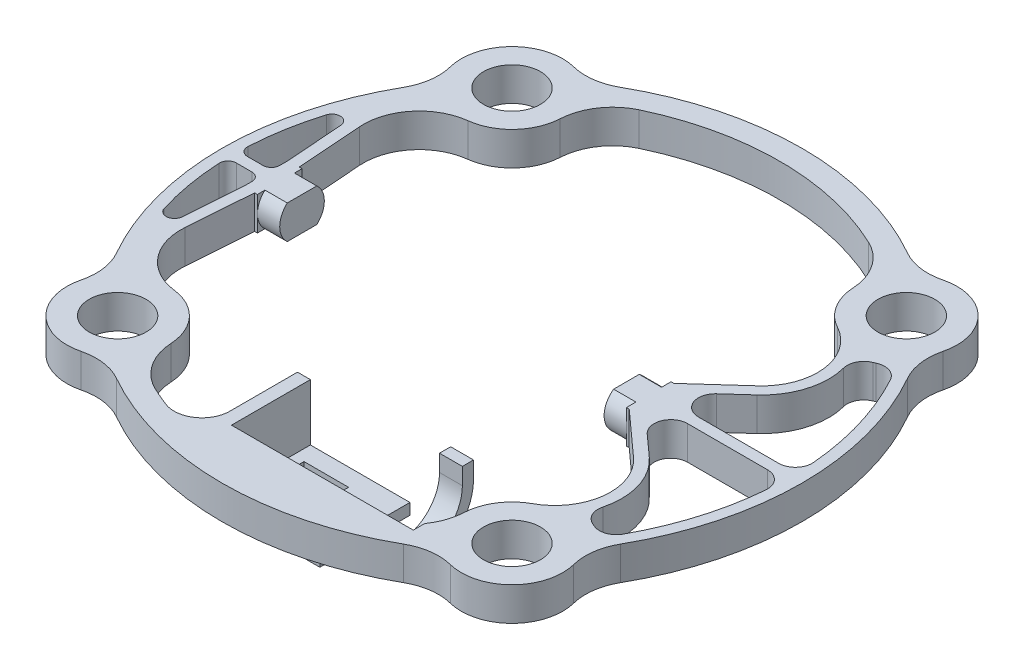
from build123d import *

# Parameters (mm, degrees)
SKETCH1_R            = 5.099999999999963
SKETCH1_R_2          = 5.099999999999999
SKETCH1_R_3          = 5.099999999999977
SKETCH1_R_4          = 5.100000000000024
BOSS_EXTRUDE1_DEPTH  = 6
FILLET1_R            = 10
BOSS_EXTRUDE2_START  = -6
BOSS_EXTRUDE2_DEPTH  = 6
BOSS_EXTRUDE3_START  = -6
BOSS_EXTRUDE3_DEPTH  = 6
FILLET2_R            = 10
CUT_EXTRUDE2_DEPTH   = 6
BOSS_EXTRUDE4_DEPTH  = 6
FILLET3_R            = 3
FILLET4_R            = 3
CUT_EXTRUDE3_START   = -6
CUT_EXTRUDE3_DEPTH   = 6
FILLET5_R            = 1.5
SKETCH8_W            = 13.196102501265209
SKETCH8_H            = 11.55899204058245
SKETCH8_R            = 4
CUT_EXTRUDE4_DEPTH   = 4
SKETCH9_W            = 12.005476711677371
SKETCH9_H            = 14.386728290853053
SKETCH9_R            = 4
CUT_EXTRUDE5_DEPTH   = 4
BOSS_EXTRUDE5_START  = -6
BOSS_EXTRUDE5_DEPTH  = 6
SKETCH11_W           = 2.3146668663284142
SKETCH11_H           = 14.149999999999995
BOSS_EXTRUDE6_DEPTH  = 6.15
BOSS_EXTRUDE7_DEPTH  = 4.1
BOSS_EXTRUDE8_DEPTH  = 6
SKETCH14_W           = 4.100000000000001
SKETCH14_H           = 2
BOSS_EXTRUDE9_DEPTH  = 3
SKETCH15_W           = 14.149999999999995
SKETCH15_H           = 2
BOSS_EXTRUDE10_DEPTH = 17.85
BOSS_EXTRUDE11_DEPTH = 2.25
SKETCH17_R           = 1.500000000000004
CUT_EXTRUDE6_DEPTH   = 3.5
CUT_EXTRUDE7_DEPTH   = 5.500000000000001
FILLET6_R            = 5
FILLET7_R            = 5
FILLET8_R            = 5
CUT_EXTRUDE8_DEPTH   = 13.5
FILLET9_R            = 5
SKETCH21_W           = 8.000000000000002
SKETCH21_H           = 8
CUT_EXTRUDE9_DEPTH   = 75.23626150898227


# Some blends are built 0.0001 mm under size
with BuildPart() as part:
    # Sketch1 → Boss-Extrude1 (new body)
    with BuildSketch(Plane(origin=(0, 0, 0), x_dir=(1, 0, 0), z_dir=(0, 1, 0))):
        with BuildLine():
            ThreePointArc((-42.589636171508175, 29.83492736338674), (-52, 6.37e-15), (-42.58963617150818, -29.834927363386726))
            ThreePointArc((-42.58963617150892, -29.834927363386416), (-41.79001076812464, -41.79001076812528), (-29.8349273633857, -42.589636171508374))
            ThreePointArc((-29.834927363385418, -42.5896361715091), (-9.55e-15, -52), (29.834927363385358, -42.589636171509134))
            ThreePointArc((29.83492736338569, -42.58963617150837), (41.790010768124965, -41.79001076812496), (42.58963617150836, -29.834927363385688))
            ThreePointArc((42.58963617150913, -29.834927363385383), (52.00000000000001, 8.2423e-13), (42.58963617150818, 29.83492736338673))
            ThreePointArc((42.58963617150892, 29.834927363386416), (41.790010768124965, 41.79001076812495), (29.834927363386427, 42.58963617150893))
            ThreePointArc((29.834927363386733, 42.58963617150818), (1.066e-14, 52), (-29.83492736338672, 42.58963617150818))
            ThreePointArc((-29.834927363386416, 42.58963617150892), (-41.79001076812496, 41.79001076812496), (-42.58963617150892, 29.83492736338642))
        make_face()
        with Locations(Location((-35.355339059327406, -35.35533905932735, 0), (0, 0, 270))):
            Circle(SKETCH1_R, mode=Mode.SUBTRACT)
        with Locations(Location((35.35533905932738, -35.35533905932738, 0), (0, 0, 270))):
            Circle(SKETCH1_R_2, mode=Mode.SUBTRACT)
        with Locations(Location((-35.3553390593274, 35.35533905932736, 0), (0, 0, 270))):
            Circle(SKETCH1_R_3, mode=Mode.SUBTRACT)
        with BuildLine():
            ThreePointArc((-27.2586404264471, -39.50906885895502), (-28.920667350529797, -28.920667350529794), (-39.50906885895502, -27.2586404264471))
            ThreePointArc((-39.509068858954805, -27.2586404264477), (-48.00000000000001, 5.88e-15), (-39.50906885895479, 27.258640426447702))
            ThreePointArc((-39.50906885895502, 27.2586404264471), (-28.920667350529797, 28.92066735052979), (-27.258640426447098, 39.50906885895501))
            ThreePointArc((-27.258640426447712, 39.50906885895479), (2.94e-15, 48.00000000000001), (27.258640426447723, 39.509068858954784))
            ThreePointArc((27.2586404264471, 39.50906885895501), (28.920667350529794, 28.9206673505298), (39.509068858955004, 27.258640426447098))
            ThreePointArc((39.509068858954784, 27.25864042644773), (48.000000000000014, -3.55e-15), (39.509068858954784, -27.258640426447727))
            ThreePointArc((39.509068858955004, -27.258640426447094), (28.920667350529797, -28.920667350529797), (27.2586404264471, -39.509068858955004))
            ThreePointArc((27.258640426447734, -39.50906885895478), (1.421e-14, -48.000000000000014), (-27.258640426447716, -39.509068858954784))
        make_face(mode=Mode.SUBTRACT)
        with Locations(Location((35.3553390593274, 35.35533905932736, 0), (0, 0, 270))):
            Circle(SKETCH1_R_4, mode=Mode.SUBTRACT)
    extrude(amount=BOSS_EXTRUDE1_DEPTH)

    # Fillet1
    fillet1_edges = [part.edges().sort_by_distance(p)[0] for p in [
        (-42.58963617150856, 3, 29.834927363386576),
        (-42.589636171508545, 3, -29.834927363386583),
        (-29.83492736338657, 3, -42.58963617150856),
        (29.834927363386583, 3, -42.58963617150856),
        (42.58963617150856, 3, -29.834927363386573),
        (42.589636171508744, 3, 29.834927363385535),
        (29.834927363385532, 3, 42.58963617150876),
        (-29.83492736338556, 3, 42.589636171508744),
        (27.258640426447418, 3, 39.50906885895489),
        (39.50906885895489, 3, 27.258640426447414),
        (39.50906885895489, 3, -27.258640426447414),
        (27.258640426447414, 3, -39.50906885895489),
        (-27.2586404264474, 3, -39.509068858954905),
        (-39.509068858954905, 3, -27.2586404264474),
        (-39.50906885895491, 3, 27.2586404264474),
        (-27.258640426447407, 3, 39.509068858954905),
    ]]
    fillet(fillet1_edges, radius=FILLET1_R)

    # Sketch2 → Boss-Extrude2 (add)
    with BuildSketch(Plane(origin=(0, 6, 0), x_dir=(1, 0, 0), z_dir=(0, 1, 0)).offset(BOSS_EXTRUDE2_START)):
        with BuildLine():
            Line((-37.65, 4), (-47.8330429724056, 4))
            ThreePointArc((-47.83304297240559, 3.9999999999999996), (-48, -1.1e-16), (-47.83304297240559, -3.9999999999999982))
            Line((-47.8330429724056, -4), (-37.65, -4))
            Line((-37.65, -4), (-37.65, 4))
        make_face()
        with BuildLine():
            ThreePointArc((47.8330429724056, -4.000000000000002), (48.000000000000014, -1.33e-15), (47.8330429724056, 4))
            Line((47.8330429724056, 4), (20.52, 4))
            Line((20.52, 4), (20.52, -4))
            Line((20.52, -4), (47.8330429724056, -4))
        make_face()
    extrude(amount=BOSS_EXTRUDE2_DEPTH)

    # Sketch3 → Boss-Extrude3 (add)
    with BuildSketch(Plane(origin=(0, 6, 0), x_dir=(1, 0, 0), z_dir=(0, 1, 0)).offset(BOSS_EXTRUDE3_START)):
        with BuildLine():
            Line((-47.8330429724056, 4), (-42.14999999999999, 4))
            Line((-42.14999999999999, 4), (-43.370230256575944, 20.567526042078697))
            ThreePointArc((-43.37023025657595, 20.5675260420787), (-46.34792327288036, 12.484791079196981), (-47.83304297240561, 4.000000000000001))
        make_face()
        with BuildLine():
            Line((-43.37023025657595, -20.56752604207868), (-42.14999999999999, -4))
            Line((-42.14999999999999, -4), (-47.8330429724056, -4))
            ThreePointArc((-47.83304297240559, -4.000000000000008), (-46.34792327288035, -12.48479107919697), (-43.37023025657595, -20.56752604207868))
        make_face()
        with BuildLine():
            Line((43.37023025657595, 20.56752604207868), (25.02, 4))
            Line((25.02, 4), (47.8330429724056, 4))
            ThreePointArc((47.8330429724056, 3.9999999999999982), (46.34792327288036, 12.484791079196969), (43.37023025657596, 20.56752604207868))
        make_face()
        with BuildLine():
            Line((47.8330429724056, -4), (25.02, -4))
            Line((25.02, -4), (43.370230256575944, -20.567526042078697))
            ThreePointArc((43.370230256575944, -20.567526042078704), (46.34792327288036, -12.484791079196986), (47.8330429724056, -4.000000000000007))
        make_face()
    extrude(amount=BOSS_EXTRUDE3_DEPTH)

    # Fillet2
    fillet2_edges = [part.edges().sort_by_distance(p)[0] for p in [
        (43.370230256575944, 2.9999999999999947, 20.567526042078697),
        (43.37023025657595, 2.9999999999999925, -20.56752604207869),
        (-43.37023025657595, 3.000000000000001, 20.56752604207869),
        (-43.37023025657594, 3.000000000000003, -20.567526042078697),
    ]]
    fillet(fillet2_edges, radius=FILLET2_R - 0.0001)  # a hair under: the kernel refuses the full size

    # Sketch5 → Cut-Extrude2 (cut)
    with BuildSketch(Plane(origin=(0, 6, 0), x_dir=(1, 0, 0), z_dir=(0, 1, 0))):
        with BuildLine():
            ThreePointArc((38.237657421795525, 18.57207711307228), (37.20349447624699, 13.698637086230962), (34.27925447259233, 9.665185574908357))
            Line((34.27925447259233, 9.665185574908358), (27.020000000000003, 3.1111595033373005))
            Line((27.020000000000003, 3.1111595033373), (27.020000000000003, -3.1111595033471926))
            Line((27.020000000000003, -3.111159503347192), (34.27925447258564, -9.66518557490234))
            ThreePointArc((34.27925447258564, -9.665185574902342), (37.20349447624515, -13.698637086226856), (38.237657421795504, -18.572077113072286))
            ThreePointArc((38.237657421795504, -18.57207711307229), (37.86190003304607, -21.55150385571701), (36.75816013599775, -24.34434032956399))
            ThreePointArc((36.75816013599784, -24.344340329564076), (39.68242206988196, -25.133482446178775), (42.28449514351011, -26.68373044494484))
            ThreePointArc((42.284495143510036, -26.683730444944835), (48.03240966876168, -13.888398806638916), (50, -1.225e-14))
            ThreePointArc((50, 0), (48.03240966876169, 13.888398806638897), (42.28449514351005, 26.68373044494482))
            ThreePointArc((42.28449514351011, 26.68373044494484), (39.682422069881966, 25.133482446178775), (36.75816013599786, 24.344340329564076))
            ThreePointArc((36.75816013599777, 24.344340329563988), (37.8619000330461, 21.551503855717), (38.237657421795525, 18.572077113072282))
        make_face()
    extrude(amount=-CUT_EXTRUDE2_DEPTH, mode=Mode.SUBTRACT)

    # Sketch6 → Boss-Extrude4 (add)
    with BuildSketch(Plane(origin=(0, 6, 0), x_dir=(1, 0, 0), z_dir=(0, 1, 0))):
        Polygon((27.020000000000003, 0.9819090006175923), (49.99035761738963, 0.9819090006175919), (51.19424294426267, 0.9819090006175919), (51.19424294426267, -1.018090999382408), (49.989633832595494, -1.018090999382408), (27.020000000000003, -1.0180909993824077), align=None)
    extrude(amount=-BOSS_EXTRUDE4_DEPTH)

    # Fillet3
    # the kernel refuses this fillet: 3 mm, written as the material it adds along each edge
    with BuildSketch(Plane(origin=(27.020000000000003, 6, -0.9819090006175923), x_dir=(0, 0, -1), z_dir=(0, -1, 0))) as fillet3_piece_1:
        with BuildLine():
            CenterArc((3, 2.8708527153070946), FILLET3_R, 180, 73.12708628528327)
            Line((-2.2e-16, 2.8708527153070946), (-0.06000000000000028, 2.8708527153070946))
            Line((-0.06000000000000028, 2.8708527153070946), (-0.06000000000000005, 0))
            Line((-0.06000000000000005, 0), (0, -0.05999999999999872))
            ThreePointArc((0, -0.05999999999999872), (1.064625251359854, -0.05999999999999872), (2.1118355127741024, -0.05741705430614275))
            Line((2.1118355127741024, -0.05741705430614275), (2.1292505027197084, 0))
        make_face()
    extrude(amount=6)
    with BuildSketch(Plane(origin=(27.020000000000003, 6, 1.0180909993824077), x_dir=(0, 0, 1), z_dir=(0, -1, 0))) as fillet3_piece_2:
        with BuildLine():
            CenterArc((3, -2.859628518094496), FILLET3_R, 107.596430009701, 72.403569990299)
            Line((2.2e-16, -2.859628518094496), (-0.05999999999999983, -2.859628518094496))
            Line((-0.05999999999999983, -2.859628518094496), (-0.06000000000000005, 0))
            Line((-0.06000000000000005, 0), (0, 0.05999999999999872))
            ThreePointArc((0, 0.05999999999999872), (1.0465342519823924, 0.05999999999999872), (2.07492987404408, 0.05719257036189163))
            Line((2.07492987404408, 0.05719257036189163), (2.0930685039647843, 0))
        make_face()
    extrude(amount=6)
    with BuildSketch(Plane(origin=(36.7581601359978, 6, 24.344340329564034), x_dir=(0.3686768777675154, 0, -0.9295576151049468), z_dir=(0, -1, 0))) as fillet3_piece_3:
        with BuildLine():
            CenterArc((3.345716556141784, 2.976878348256868), FILLET3_R, 180.89962430391978, 81.98224825656462)
            Line((0.3460863497763565, 2.9297760652963665), (0.28609374564904577, 2.928834019637155))
            ThreePointArc((0.28609374564904577, 2.928834019637155), (0.21122512417191133, 1.4603777045000785), (-0.05812186710148964, 0.01489458172076869))
            Line((-0.05812186710148964, 0.01489458172076869), (0.00743492568031723, -0.05953756696513596))
            ThreePointArc((0.00743492568031723, -0.05953756696513596), (1.4869851360630424, 0.03248660697253327), (2.966535346445779, -0.05953756696513431))
            Line((2.966535346445779, -0.05953756696513431), (2.973970272126092, -1.5e-16))
        make_face()
    extrude(amount=6)
    with BuildSketch(Plane(origin=(42.28449514351007, 6, 26.68373044494484), x_dir=(-0.8512706925591004, 0, -0.5247267936649983), z_dir=(0, -1, 0))) as fillet3_piece_4:
        with BuildLine():
            CenterArc((3.0611464220846627, 2.97778381773632), FILLET3_R, 177.01132377378212, 86.01149357067823)
            Line((0.06522684574595612, 3.1341995845583397), (0.00530845421918353, 3.1373278998947787))
            ThreePointArc((0.00530845421918353, 3.1373278998947787), (-0.05194296104754635, 1.5688595226543562), (-0.05999666374167063, -0.00063272416503647))
            Line((-0.05999666374167063, -0.00063272416503647), (0.00728844386210776, -0.05955567635472604))
            ThreePointArc((0.00728844386210776, -0.05955567635472604), (1.3483621144896634, 0.02219987437561363), (2.689435785117221, -0.05955567635472756))
            Line((2.689435785117221, -0.05955567635472756), (2.696724228979326, 2e-17))
        make_face()
    extrude(amount=6)
    with BuildSketch(Plane(origin=(49.9896338325955, 0, 1.018090999382408), x_dir=(-0.0529547236137434, 0, 0.9985969142987535), z_dir=(0, 1, 0))) as fillet3_piece_5:
        with BuildLine():
            CenterArc((3.1632179426355167, -2.998404409178422), FILLET3_R, 88.13122498852314, 94.90427700248017)
            Line((0.16742719973925577, -3.157268580019652), (0.1075113848813305, -3.1604458634364767))
            Line((0.1075113848813305, -3.1604458634364767), (-0.05991581485792526, -0.00317728341682461))
            Line((-0.05991581485792526, -0.00317728341682461), (-0.00195662965523841, 0.05996808818356544))
            ThreePointArc((-0.00195662965523841, 0.05996808818356544), (1.6305247126987177, 0.08659318035961931), (3.2630060550526774, 0.05996808818356832))
            Line((3.2630060550526774, 0.05996808818356832), (3.261049425397439, 0))
        make_face()
    extrude(amount=6)
    with BuildSketch(Plane(origin=(49.99035761738964, 0, -0.9819090006175919), x_dir=(-0.05220754978421727, 0, -0.9986362559738798), z_dir=(0, 1, 0))) as fillet3_piece_6:
        with BuildLine():
            CenterArc((3.160850062556177, 2.99840679773152), FILLET3_R, 177.00736721989773, 94.86000839284759)
            Line((0.16494129463453752, 3.1550294470841647), (0.10502311927610468, 3.1581619000712178))
            Line((0.10502311927610468, 3.1581619000712178), (-0.05991817535843284, 0.00313245298705304))
            Line((-0.05991817535843284, 0.00313245298705304), (-0.00195516498714811, -0.05996813595462845))
            ThreePointArc((-0.00195516498714811, -0.05996813595462845), (1.629304155956785, -0.08655337114138394), (3.2605634769007272, -0.05996813595463082))
            Line((3.2605634769007272, -0.05996813595463082), (3.2586083119135796, 0))
        make_face()
    extrude(amount=6)
    with BuildSketch(Plane(origin=(36.75816013599781, 6, -24.34434032956403), x_dir=(0.3686768777675187, 0, 0.9295576151049456), z_dir=(0, -1, 0))) as fillet3_piece_7:
        with BuildLine():
            CenterArc((3.3457165561417908, -2.9768783482568657), FILLET3_R, 97.11812743951585, 81.9822482565646)
            Line((0.34608634977635955, -2.9297760652963762), (0.2860937456490488, -2.9288340196371645))
            ThreePointArc((0.2860937456490488, -2.9288340196371645), (0.21122512417191577, -1.4603777045000856), (-0.05812186710148959, -0.0148945817207689))
            Line((-0.05812186710148959, -0.0148945817207689), (0.00743492568031702, 0.05953756696513599))
            ThreePointArc((0.00743492568031702, 0.05953756696513599), (1.486985136063038, -0.03248660697254525), (2.9665353464457715, 0.05953756696513415))
            Line((2.9665353464457715, 0.05953756696513415), (2.973970272126085, -5e-17))
        make_face()
    extrude(amount=6)
    with BuildSketch(Plane(origin=(42.284495143510085, 6, -26.683730444944832), x_dir=(0.5069009623645678, 0, 0.8620043006585727), z_dir=(0, -1, 0))) as fillet3_piece_8:
        with BuildLine():
            CenterArc((3.040831892432753, 2.998525518414092), FILLET3_R, 185.78495367741579, 86.01149357067038)
            Line((0.05611025432539941, 2.69614042781974), (-0.00358417843674884, 2.690092726007855))
            ThreePointArc((-0.00358417843674884, 2.690092726007855), (0.05025019559160608, 1.3476083051303924), (-0.0593911340901195, 0.00852603023038361))
            Line((-0.0593911340901195, 0.00852603023038361), (-0.00188092694377259, -0.05997051036828272))
            ThreePointArc((-0.00188092694377259, -0.05997051036828272), (1.5674391198106752, -0.08457469309852138), (3.1367591665651227, -0.05997051036828362))
            Line((3.1367591665651227, -0.05997051036828362), (3.13487823962135, -1.7e-16))
        make_face()
    extrude(amount=6)

    # Fillet4
    fillet4_edges = [part.edges().sort_by_distance(p)[0] for p in [
        (27.020000000000003, 3, -3.1111595033373005),
    ]]
    fillet(fillet4_edges, radius=FILLET4_R)
    fillet4_2_edges = [part.edges().sort_by_distance(p)[0] for p in [
        (27.020000000000003, 3, 3.111159503347192),
    ]]
    fillet(fillet4_2_edges, radius=FILLET4_R)

    # Sketch7 → Cut-Extrude3 (cut)
    with BuildSketch(Plane.XZ.offset(CUT_EXTRUDE3_START)):
        with BuildLine():
            Line((-44.14999999999999, 3.9264476838978197), (-45.403197170618576, 20.941577941643605))
            ThreePointArc((-45.40319717061856, 20.94157794164361), (-48.72763180786275, 11.20793907894589), (-49.98999899979993, 1.000000000001045))
            Line((-49.98999899979991, 0.9999999999999938), (-44.14999999999999, 0.9999999999999946))
            Line((-44.14999999999999, 0.9999999999999947), (-44.14999999999999, 3.9264476838978197))
        make_face()
        with BuildLine():
            ThreePointArc((-49.98999899979993, -1.0000000000010327), (-48.72763180786276, -11.207939078945877), (-45.403197170618554, -20.941577941643637))
            Line((-45.40319717061855, -20.941577941643633), (-44.14999999999999, -3.9264476838977123))
            Line((-44.14999999999999, -3.9264476838977123), (-44.14999999999999, -1))
            Line((-44.14999999999999, -1), (-49.98999899979991, -1))
        make_face()
    extrude(amount=CUT_EXTRUDE3_DEPTH, mode=Mode.SUBTRACT)

    # Fillet5
    # the kernel refuses this fillet: 1.5 mm, written as the material it adds along each edge
    with BuildSketch(Plane(origin=(-45.40319717061857, 6, 20.941577941643608), x_dir=(-0.35566095703559125, 0, -0.9346150456955673), z_dir=(0, -1, 0))) as fillet5_piece_1:
        with BuildLine():
            CenterArc((6.745613455376667, 1.4964783855270851), FILLET5_R, 115.0462972690573, 158.88058526223008)
            Line((6.110587770722799, 2.855427383771646), (0, 0))
            ThreePointArc((0, 0), (3.4241692666886636, -0.11738714909708475), (6.848338533377325, 3e-17))
        make_face()
    extrude(amount=6)
    with BuildSketch(Plane(origin=(-44.14999999999999, 6, 3.9264476838978197), x_dir=(-0.07345297200060777, 0, 0.9972986818923797), z_dir=(0, -1, 0))) as fillet5_piece_2:
        with BuildLine():
            CenterArc((FILLET5_R * 0.0367761580511, FILLET5_R), FILLET5_R, 265.78766107236066, 4.212338927640246)
            Line((-FILLET5_R * 0.0366768139495, FILLET5_R * 0.00270131810762), (0, 0))
            Line((0, 0), (FILLET5_R * 0.0367761580511, 0))
        make_face()
    extrude(amount=6)
    with BuildSketch(Plane(origin=(-44.14999999999999, 6, 0.9999999999999947), x_dir=(0, 0, 1), z_dir=(0, -1, 0))) as fillet5_piece_3:
        with BuildLine():
            CenterArc((FILLET5_R, FILLET5_R), FILLET5_R, 180, 90)
            Line((0, FILLET5_R), (0, 0))
            Line((0, 0), (FILLET5_R, 0))
        make_face()
    extrude(amount=6)
    with BuildSketch(Plane(origin=(-49.98999899979992, 6, 1.0000000000005203), x_dir=(0.0357776524855417, 0, 0.9993597748471889), z_dir=(0, -1, 0))) as fillet5_piece_4:
        with BuildLine():
            CenterArc((1.5546551231276617, -1.4998131539261013), FILLET5_R, 89.09564593035947, 92.95470013766749)
            Line((0.05561546085687804, -1.5534796326543996), (0, 0))
            ThreePointArc((0, 0), (0.7891650371206554, 0.00622820246320295), (1.5783300742413102, 0))
        make_face()
    extrude(amount=6)
    with BuildSketch(Plane(origin=(-49.98999899979992, 6, -1.0000000000005165), x_dir=(1, 0, 3.3225e-13), z_dir=(0, -1, 0))) as fillet5_piece_5:
        with BuildLine():
            CenterArc((1.554474846550007, -1.5), FILLET5_R, 89.99999999998097, 92.95470013766811)
            ThreePointArc((0.0564689449030968, -1.57731958762837), (0.02201025744025821, -0.7888826242775202), (0, 0))
            Line((0, 0), (1.5544748465505052, 0))
        make_face()
    extrude(amount=6)
    with BuildSketch(Plane(origin=(-44.14999999999999, 6, -1), x_dir=(-1, 0, 0), z_dir=(0, -1, 0))) as fillet5_piece_6:
        with BuildLine():
            CenterArc((FILLET5_R, FILLET5_R), FILLET5_R, 180, 90)
            Line((0, FILLET5_R), (0, 0))
            Line((0, 0), (FILLET5_R, 0))
        make_face()
    extrude(amount=6)
    with BuildSketch(Plane(origin=(-44.14999999999999, 6, -3.9264476838977123), x_dir=(0, 0, 1), z_dir=(0, -1, 0))) as fillet5_piece_7:
        with BuildLine():
            CenterArc((FILLET5_R * 0.0367761580511, FILLET5_R), FILLET5_R, 265.78766107236, 4.212338927640019)
            Line((-FILLET5_R * 0.0366768139495, FILLET5_R * 0.00270131810762), (0, 0))
            Line((0, 0), (FILLET5_R * 0.0367761580511, 0))
        make_face()
    extrude(amount=6)
    with BuildSketch(Plane(origin=(-45.40319717061855, 6, -20.941577941643637), x_dir=(0.07345297200062204, 0, 0.9972986818923786), z_dir=(0, -1, 0))) as fillet5_piece_8:
        with BuildLine():
            CenterArc((6.744831239378959, 1.5000000000000004), FILLET5_R, 111.11941473771157, 158.8805852622885)
            ThreePointArc((6.204361859716742, 2.8992472439306565), (3.052485026709371, 1.5559723877450613), (0, 0))
            Line((0, 0), (6.744831239378961, -2e-17))
        make_face()
    extrude(amount=6)

    # Sketch8 → Cut-Extrude4 (cut)
    with BuildSketch(Plane(origin=(-37.65, 0, 0), x_dir=(0, 0, -1), z_dir=(1, 0, 0))):
        with Locations((0, 2.9999999999999996)):
            Rectangle(SKETCH8_W, SKETCH8_H)
        with Locations((0, 3)):
            Circle(SKETCH8_R, mode=Mode.SUBTRACT)
    extrude(amount=-CUT_EXTRUDE4_DEPTH, mode=Mode.SUBTRACT)

    # Sketch9 → Cut-Extrude5 (cut)
    with BuildSketch(Plane.ZY.offset(-20.52)):
        with Locations((0, 2.727148256552649)):
            Rectangle(SKETCH9_W, SKETCH9_H)
        with Locations((0, 2.7271482565526486)):
            Circle(SKETCH9_R, mode=Mode.SUBTRACT)
    extrude(amount=-CUT_EXTRUDE5_DEPTH, mode=Mode.SUBTRACT)

    # Sketch10 → Boss-Extrude5 (add)
    with BuildSketch(Plane(origin=(0, 6, 0), x_dir=(1, 0, 0), z_dir=(0, 1, 0)).offset(BOSS_EXTRUDE5_START)):
        with BuildLine():
            Line((-10.464666866328413, -28), (-10.464666866328413, -46.84539195456443))
            ThreePointArc((-10.464666866328413, -46.84539195456443), (4.459052848216454, -47.7924350467395), (18.95000000000001, -44.100992052333716))
            Line((18.95000000000001, -44.100992052333716), (18.95000000000001, -42.15))
            Line((18.95000000000001, -42.15), (14.700000000000006, -42.15))
            Line((14.700000000000006, -42.15), (-8.149999999999999, -42.15))
            Line((-8.149999999999999, -42.15), (-8.149999999999997, -28))
            Line((-8.149999999999997, -28), (-10.464666866328413, -28))
        make_face()
    extrude(amount=BOSS_EXTRUDE5_DEPTH)

    # Sketch11 → Boss-Extrude6 (add)
    with BuildSketch(Plane.XZ):
        Polygon((-10.464666866328413, 44.15), (-10.464666866328413, 42.15), (-8.149999999999999, 42.15), (9.700000000000005, 42.15), (9.700000000000005, 44.15), align=None)
        with Locations((-9.307333433164207, 35.075)):
            Rectangle(SKETCH11_W, SKETCH11_H)
    extrude(amount=BOSS_EXTRUDE6_DEPTH)

    # Sketch12 → Boss-Extrude7 (add)
    with BuildSketch(Plane(origin=(18.95000000000001, 0, 0), x_dir=(0, 0, -1), z_dir=(1, 0, 0))):
        with BuildLine():
            Line((-25.850000000000005, 3), (-27.85, 3))
            ThreePointArc((-27.85, 2.9999999999999982), (-35, -4.149999999999999), (-42.15, 3.000000000000001))
            Line((-42.15, 3.000000000000028), (-42.15, 0))
            Line((-42.15, 0), (-43.644217720534414, 0))
            ThreePointArc((-43.644217720534385, 1.1768e-13), (-33.478831393778066, -6.022668456251997), (-25.85, 2.999999999999998))
        make_face()
    extrude(amount=-BOSS_EXTRUDE7_DEPTH)

    # Sketch13 → Boss-Extrude8 (add)
    with BuildSketch(Plane(origin=(0, 6, 0), x_dir=(1, 0, 0), z_dir=(0, 1, 0))):
        Polygon((18.95000000000001, -42.15), (24.139354243800483, -42.15), (18.95000000000001, -46.44899679624902), align=None)
    extrude(amount=-BOSS_EXTRUDE8_DEPTH)

    # Sketch14 → Boss-Extrude9 (add)
    with BuildSketch(Plane(origin=(0, 3, 0), x_dir=(1, 0, 0), z_dir=(0, 1, 0))):
        with Locations((16.90000000000001, -26.85000000000001)):
            Rectangle(SKETCH14_W, SKETCH14_H)
    extrude(amount=BOSS_EXTRUDE9_DEPTH)

    # Sketch15 → Boss-Extrude10 (add)
    with BuildSketch(Plane(origin=(-8.149999999999993, 0, -1e-15), x_dir=(1.2e-16, 0, -1), z_dir=(1, 0, 1.2e-16))):
        with Locations((-35.075, -5.15)):
            Rectangle(SKETCH15_W, SKETCH15_H)
    extrude(amount=BOSS_EXTRUDE10_DEPTH)

    # Sketch16 → Boss-Extrude11 (add)
    with BuildSketch(Plane(origin=(0, -6.15, 0), x_dir=(-1, 0, 0), z_dir=(0, -1, 0))):
        Polygon((-9.700000000000003, -42.15), (-4.700000000000002, -42.15), (-4.700000000000003, -28), (-9.700000000000003, -28.000000000000004), align=None)
    extrude(amount=BOSS_EXTRUDE11_DEPTH)

    # Sketch17 → Cut-Extrude6 (cut)
    with BuildSketch(Plane(origin=(9.700000000000005, 0, 0), x_dir=(0, 0, -1), z_dir=(1, 0, 0))):
        with Locations((-35.42111724023818, -6.275)):
            Circle(SKETCH17_R)
    extrude(amount=-CUT_EXTRUDE6_DEPTH, mode=Mode.SUBTRACT)

    # Sketch18 → Cut-Extrude7 (cut)
    with BuildSketch(Plane(origin=(9.700000000000005, 0, 0), x_dir=(0, 0, -1), z_dir=(1, 0, 0))):
        with BuildLine():
            Line((-37.542437583797835, -6.15), (-42.15, -6.15))
            Line((-42.15, -6.15), (-42.15, -8.4))
            Line((-42.15, -8.4), (-35.421117240238374, -8.4))
            ThreePointArc((-35.421117240238374, -8.400000000000002), (-36.96728184984486, -7.7327379737112745), (-37.54243758379783, -6.150000000000048))
        make_face()
        with BuildLine():
            Line((-28, -6.15), (-33.299796896678544, -6.15))
            ThreePointArc((-33.29979689667854, -6.149999999999951), (-33.29703735355027, -6.212472926120896), (-33.29611724023818, -6.275))
            ThreePointArc((-33.29611724023818, -6.275000000000001), (-33.918515330216835, -7.777601910021484), (-35.421117240238374, -8.400000000000002))
            Line((-35.421117240238374, -8.4), (-28.000000000000004, -8.4))
            Line((-28.000000000000004, -8.4), (-28, -6.15))
        make_face()
    extrude(amount=-CUT_EXTRUDE7_DEPTH, mode=Mode.SUBTRACT)

    # Fillet6
    fillet6_edges = [part.edges().sort_by_distance(p)[0] for p in [
        (7.200000000000003, -6.150000000000024, 37.542437583797835),
        (7.200000000000004, -6.1499999999999755, 33.299796896678544),
    ]]
    fillet(fillet6_edges, radius=FILLET6_R)

    # Fillet7
    # the kernel refuses this fillet: 5 mm, written as the material it adds along each edge
    with BuildSketch(Plane(origin=(9.700000000000005, 0, 44.15), x_dir=(0, -1, 0), z_dir=(-1, 0, 0))) as fillet7_piece_1:
        with BuildLine():
            CenterArc((FILLET7_R, FILLET7_R), FILLET7_R, 179.99999999999991, 90.00000000000011)
            Line((-8.9e-16, FILLET7_R), (0, 0))
            Line((0, 0), (FILLET7_R, 0))
        make_face()
    extrude(amount=20.164666866328417)

    # Fillet8
    fillet8_edges = [part.edges().sort_by_distance(p)[0] for p in [
        (-10.464666866328415, 3, 46.845391954564434),
    ]]
    fillet(fillet8_edges, radius=FILLET8_R)

    # Sketch19 → Cut-Extrude8 (cut)
    with BuildSketch(Plane(origin=(0, 6, 0), x_dir=(1, 0, 0), z_dir=(0, 1, 0))):
        Polygon((18.95000000000001, -25.850000000000005), (24.450000000000006, -25.850000000000005), (24.45000000000001, -42.15), (18.950000000000014, -42.15), align=None)
    extrude(amount=-CUT_EXTRUDE8_DEPTH, mode=Mode.SUBTRACT)

    # Fillet9
    fillet9_edges = [part.edges().sort_by_distance(p)[0] for p in [
        (16.90000000000001, 5.884e-14, 43.6442177205344),
    ]]
    fillet(fillet9_edges, radius=FILLET9_R)

    # Sketch21 → Cut-Extrude9 (cut, through all)
    with BuildSketch(Plane(origin=(0, -4.15, 0), x_dir=(1, 0, 0), z_dir=(0, 1, 0))):
        with Locations((-2.1500000000000012, -35.150000000000006)):
            Rectangle(SKETCH21_W, SKETCH21_H)
    extrude(amount=-CUT_EXTRUDE9_DEPTH, mode=Mode.SUBTRACT)


solid = part.part
